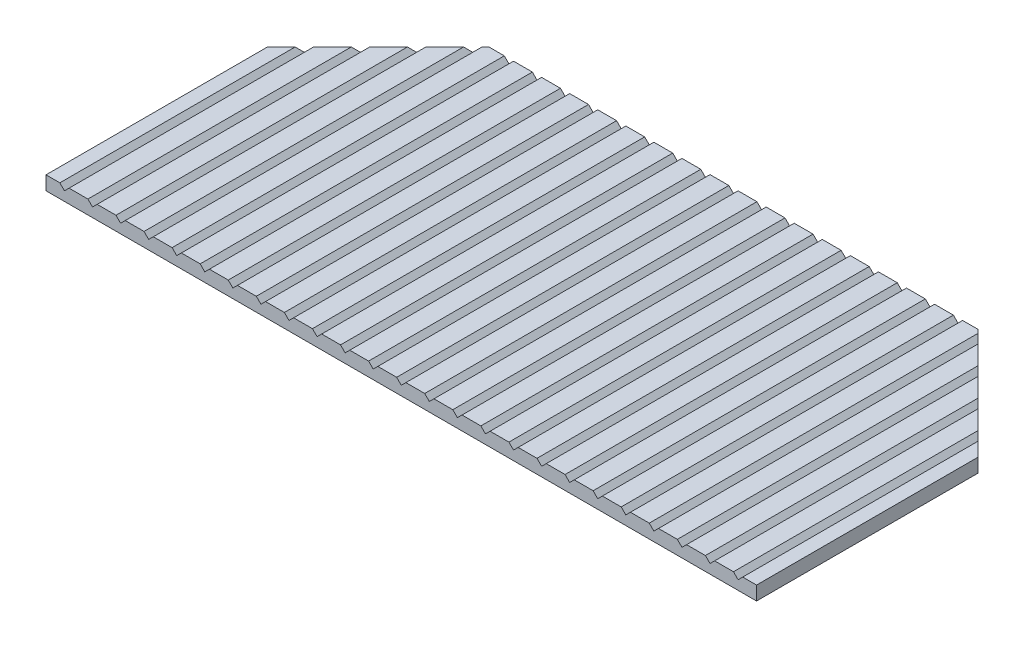
from build123d import *

# Parameters (mm, degrees)
BOSS_EXTRUDE1_DEPTH = 1.5
SKETCH2_W           = 1
SKETCH2_H           = 36
CUT_EXTRUDE1_DEPTH  = 0.5
SKETCH3_W           = 30
SKETCH3_H           = 2
BOSS_EXTRUDE2_DEPTH = 2
CHAMFER1_SIZE       = 0.5


with BuildPart() as part:
    # Sketch1 → Boss-Extrude1 (new body)
    with BuildSketch(Plane(origin=(0, 0, 0), x_dir=(1, 0, 0), z_dir=(0, 1, 0))):
        Polygon((-38.5, 8.06761956), (-26.5, 20.06761956), (26.5, 20.06761956), (38.5, 8.06761956), (38.5, -15.93238044), (-38.5, -15.93238044), align=None)
    extrude(amount=BOSS_EXTRUDE1_DEPTH)

    # Sketch2 → Cut-Extrude1 (cut)
    with BuildSketch(Plane(origin=(0, 1.5, 0), x_dir=(1, 0, 0), z_dir=(0, 1, 0))):
        with Locations((-36.5, 2.06761956)):
            Rectangle(SKETCH2_W, SKETCH2_H)
        with Locations((-33.458333333, 2.06761956)):
            Rectangle(SKETCH2_W, SKETCH2_H)
        with Locations((-30.416666667, 2.06761956)):
            Rectangle(SKETCH2_W, SKETCH2_H)
        with Locations((-27.375, 2.06761956)):
            Rectangle(SKETCH2_W, SKETCH2_H)
        with Locations((-24.333333333, 2.06761956)):
            Rectangle(SKETCH2_W, SKETCH2_H)
        with Locations((-21.291666667, 2.06761956)):
            Rectangle(SKETCH2_W, SKETCH2_H)
        with Locations((-18.25, 2.06761956)):
            Rectangle(SKETCH2_W, SKETCH2_H)
        with Locations((-15.208333333, 2.06761956)):
            Rectangle(SKETCH2_W, SKETCH2_H)
        with Locations((-12.166666667, 2.06761956)):
            Rectangle(SKETCH2_W, SKETCH2_H)
        with Locations((-9.125, 2.06761956)):
            Rectangle(SKETCH2_W, SKETCH2_H)
        with Locations((-6.083333333, 2.06761956)):
            Rectangle(SKETCH2_W, SKETCH2_H)
        with Locations((-3.041666667, 2.06761956)):
            Rectangle(SKETCH2_W, SKETCH2_H)
        with Locations((0, 2.06761956)):
            Rectangle(SKETCH2_W, SKETCH2_H)
        with Locations((3.041666667, 2.06761956)):
            Rectangle(SKETCH2_W, SKETCH2_H)
        with Locations((6.083333333, 2.06761956)):
            Rectangle(SKETCH2_W, SKETCH2_H)
        with Locations((9.125, 2.06761956)):
            Rectangle(SKETCH2_W, SKETCH2_H)
        with Locations((12.166666667, 2.06761956)):
            Rectangle(SKETCH2_W, SKETCH2_H)
        with Locations((15.208333333, 2.06761956)):
            Rectangle(SKETCH2_W, SKETCH2_H)
        with Locations((18.25, 2.06761956)):
            Rectangle(SKETCH2_W, SKETCH2_H)
        with Locations((21.291666667, 2.06761956)):
            Rectangle(SKETCH2_W, SKETCH2_H)
        with Locations((24.333333333, 2.06761956)):
            Rectangle(SKETCH2_W, SKETCH2_H)
        with Locations((27.375, 2.06761956)):
            Rectangle(SKETCH2_W, SKETCH2_H)
        with Locations((30.416666667, 2.06761956)):
            Rectangle(SKETCH2_W, SKETCH2_H)
        with Locations((33.458333333, 2.06761956)):
            Rectangle(SKETCH2_W, SKETCH2_H)
        with Locations((36.5, 2.06761956)):
            Rectangle(SKETCH2_W, SKETCH2_H)
    extrude(amount=-CUT_EXTRUDE1_DEPTH, mode=Mode.SUBTRACT)

    # Sketch3 → Boss-Extrude2 (add)
    with BuildSketch(Plane.XZ):
        with Locations((0, -1.06761956)):
            Rectangle(SKETCH3_W, SKETCH3_H)
    extrude(amount=BOSS_EXTRUDE2_DEPTH)

    # Chamfer1
    chamfer1_edges = [part.edges().sort_by_distance(p)[0] for p in [
        (36, 1, 2.68238044),
        (32.958333333, 1, 1.161547107),
        (37, 1, 3.18238044),
        (33.958333333, 1, 1.661547107),
        (30.916666667, 1, 0.140713774),
        (27.875, 1, -1.38011956),
        (24.833333333, 1, -2.06761956),
        (21.791666667, 1, -2.06761956),
        (18.75, 1, -2.06761956),
        (15.708333333, 1, -2.06761956),
        (29.916666667, 1, -0.359286226),
        (26.875, 1, -1.88011956),
        (23.833333333, 1, -2.06761956),
        (20.791666667, 1, -2.06761956),
        (17.75, 1, -2.06761956),
        (14.708333333, 1, -2.06761956),
        (11.666666667, 1, -2.06761956),
        (8.625, 1, -2.06761956),
        (5.583333333, 1, -2.06761956),
        (2.541666667, 1, -2.06761956),
        (12.666666667, 1, -2.06761956),
        (9.625, 1, -2.06761956),
        (6.583333333, 1, -2.06761956),
        (3.541666667, 1, -2.06761956),
        (0.5, 1, -2.06761956),
        (-2.541666667, 1, -2.06761956),
        (-5.583333333, 1, -2.06761956),
        (-8.625, 1, -2.06761956),
        (-11.666666667, 1, -2.06761956),
        (-14.708333333, 1, -2.06761956),
        (-17.75, 1, -2.06761956),
        (-20.791666667, 1, -2.06761956),
        (-0.5, 1, -2.06761956),
        (-3.541666667, 1, -2.06761956),
        (-6.583333333, 1, -2.06761956),
        (-9.625, 1, -2.06761956),
        (-12.666666667, 1, -2.06761956),
        (-15.708333333, 1, -2.06761956),
        (-18.75, 1, -2.06761956),
        (-21.791666667, 1, -2.06761956),
        (-24.833333333, 1, -2.06761956),
        (-27.875, 1, -1.38011956),
        (-23.833333333, 1, -2.06761956),
        (-26.875, 1, -1.88011956),
        (-29.916666667, 1, -0.359286226),
        (-30.916666667, 1, 0.140713774),
        (-33.958333333, 1, 1.661547107),
        (-32.958333333, 1, 1.161547107),
        (-36, 1, 2.68238044),
        (-37, 1, 3.18238044),
    ]]
    chamfer(chamfer1_edges, length=CHAMFER1_SIZE - 0.0001)  # a hair under: the kernel refuses the full size


solid = part.part
